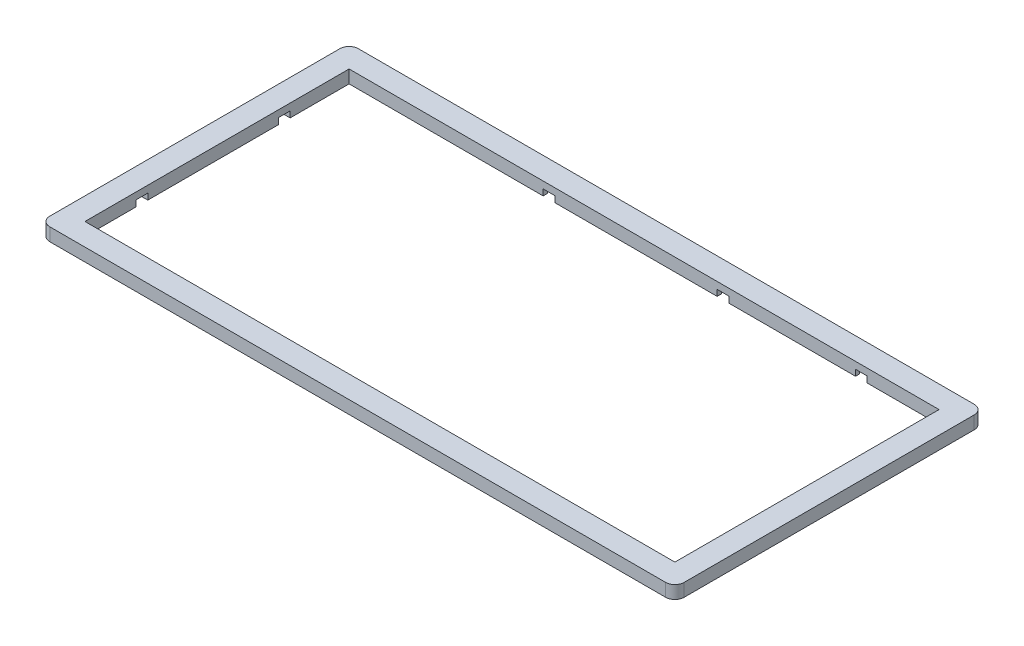
from build123d import *

# Parameters (mm, degrees)
SKETCH1_W           = 343.08
SKETCH1_H           = 166.875
SKETCH1_W_2         = 319.08
SKETCH1_H_2         = 142.875
BOSS_EXTRUDE1_DEPTH = 7
FILLET1_R           = 5
FILLET2_R           = 5
FILLET3_R           = 5
CUT_EXTRUDE2_DEPTH  = 3.3
FILLET5_R           = 5


with BuildPart() as part:
    # Sketch1 → Boss-Extrude1 (new body)
    with BuildSketch(Plane(origin=(0, 0, 0), x_dir=(1, 0, 0), z_dir=(0, 1, 0))):
        with Locations((0, 7.344975928)):
            Rectangle(SKETCH1_W, SKETCH1_H)
        with Locations((0, 7.344975928)):
            Rectangle(SKETCH1_W_2, SKETCH1_H_2, mode=Mode.SUBTRACT)
    extrude(amount=BOSS_EXTRUDE1_DEPTH)

    # Fillet1
    fillet1_edges = [part.edges().sort_by_distance(p)[0] for p in [
        (171.54, 3.5, 76.092524072),
    ]]
    fillet(fillet1_edges, radius=FILLET1_R)

    # Fillet2
    fillet2_edges = [part.edges().sort_by_distance(p)[0] for p in [
        (-171.54, 3.5, -90.782475928),
    ]]
    fillet(fillet2_edges, radius=FILLET2_R)

    # Fillet3
    fillet3_edges = [part.edges().sort_by_distance(p)[0] for p in [
        (-171.54, 3.5, 76.092524072),
    ]]
    fillet(fillet3_edges, radius=FILLET3_R)

    # Sketch3 → Cut-Extrude2 (cut)
    with BuildSketch(Plane.XZ):
        Polygon((-23.85, -81.082475928), (-48.3, -81.082475928), (-48.3, -78.782475928), (-54.6, -78.782475928), (-54.6, -81.082475928), (-79.05, -81.082475928), (-79.05, -85.582475928), (-23.85, -85.582475928), align=None)
        Polygon((145.09, -81.082475928), (120.64, -81.082475928), (120.64, -78.782475928), (114.34, -78.782475928), (114.34, -81.082475928), (89.89, -81.082475928), (89.89, -85.582475928), (145.09, -85.582475928), align=None)
        Polygon((70.122778139, -85.582130786), (70.178511085, -81.082475928), (45.8, -81.082475928), (45.8, -78.782475928), (39.5, -78.782475928), (39.5, -81.082475928), (14.978511085, -81.082475928), (14.922778139, -85.582130786), align=None)
        Polygon((-159.54, 36.392524072), (-159.54, 30.092524072), (-162.84, 30.092524072), (-162.84, 10.092524072), (-167.34, 10.092524072), (-167.34, 56.392524072), (-162.84, 56.392524072), (-162.84, 36.392524072), align=None)
        Polygon((-159.54, -40.582475928), (-159.54, -46.882475928), (-162.84, -46.882475928), (-162.84, -71.332475928), (-167.34, -71.332475928), (-167.34, -16.132475928), (-162.84, -16.132475928), (-162.84, -40.582475928), align=None)
        Polygon((161.84, 10.092524072), (161.84, 30.092524072), (159.54, 30.092524072), (159.54, 36.392524072), (161.84, 36.392524072), (161.84, 56.392524072), (166.34, 56.392524072), (166.34, 10.092524072), align=None)
        Polygon((159.54, -40.582475928), (161.84, -40.582475928), (161.84, -16.132475928), (166.34, -16.132475928), (166.34, -71.332475928), (161.84, -71.332475928), (161.84, -46.882475928), (159.54, -46.882475928), align=None)
        Polygon((145.108065102, 71.892523882), (145.109369466, 67.392524072), (120.64, 67.392524072), (120.64, 64.092524072), (114.34, 64.092524072), (114.34, 67.392524072), (89.870630534, 67.392524072), (89.908065102, 71.892523882), align=None)
        Polygon((14.951158069, 71.892524072), (70.151158069, 71.892524072), (70.151158069, 67.392524072), (45.75, 67.392524072), (45.75, 64.092524072), (39.45, 64.092524072), (39.45, 67.392524072), (14.978332725, 67.392524072), align=None)
        Polygon((-23.81002996, 71.892524072), (-23.81002996, 67.392524072), (-48.280059919, 67.392524072), (-48.280059919, 64.092524072), (-54.54, 64.092524072), (-54.54, 67.392524072), (-79.01002996, 67.392524072), (-79.01002996, 71.892524072), align=None)
        Polygon((-98.74397195, 71.892522778), (-98.740559297, 67.392524072), (-123.14, 67.392524072), (-123.14, 64.092524072), (-129.44, 64.092524072), (-129.44, 67.392524072), (-153.839440703, 67.392524072), (-153.94397195, 71.892522778), align=None)
    extrude(amount=-CUT_EXTRUDE2_DEPTH, mode=Mode.SUBTRACT)

    # Fillet5
    fillet5_edges = [part.edges().sort_by_distance(p)[0] for p in [
        (171.54, 3.5, -90.782475928),
    ]]
    fillet(fillet5_edges, radius=FILLET5_R)


solid = part.part
